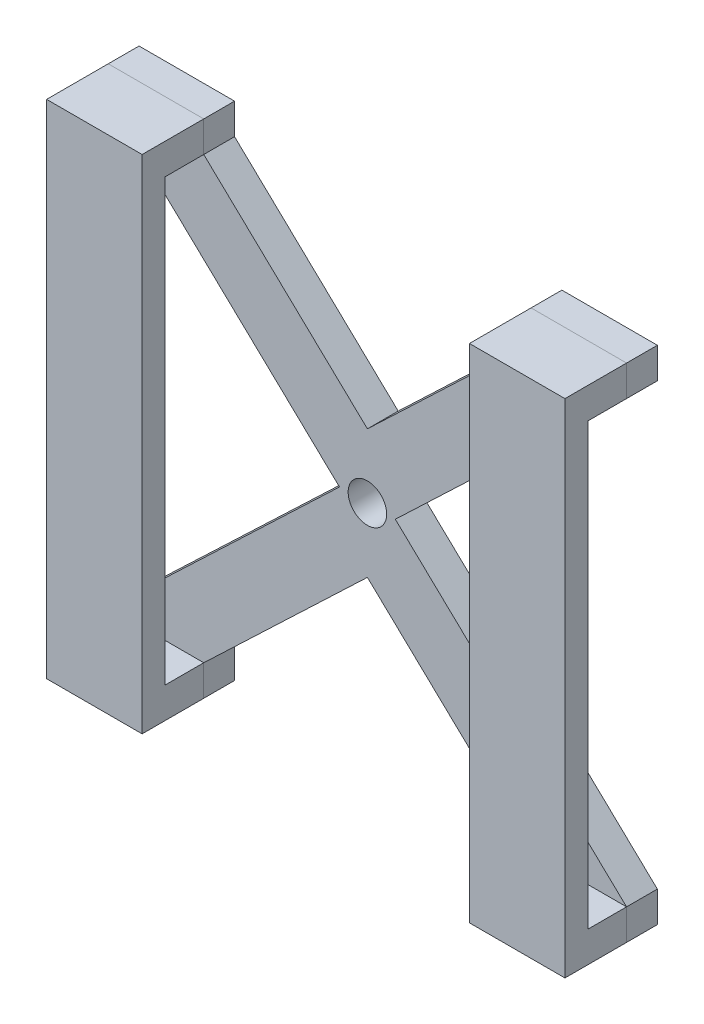
from build123d import *

# Parameters (mm, degrees)
DODANIE_WYCI_GNI_CIE1_DEPTH = 4
SZKIC2_W                    = 12.398850507
SZKIC2_H                    = 4
DODANIE_WYCI_GNI_CIE2_DEPTH = 8
SZKIC3_W                    = 12.398850507
SZKIC3_H                    = 65.15
DODANIE_WYCI_GNI_CIE3_DEPTH = 3
SZKIC4_R                    = 2.5
WYTNIJ_WYCI_GNI_CIE1_DEPTH  = 10


with BuildPart() as part:
    # Szkic1 → Dodanie-wyciągnięcie1 (new body)
    with BuildSketch(Plane.XY):
        Polygon((21.25, -28.575), (0, -8.351140655), (-21.25, -28.575), (-21.25, -32.575), (-33.648850507, -32.575), (-33.648850507, -28.575), (-27.730490071, -22.942431105), (-3.623980395, 0), (-27.730490071, 22.942431105), (-33.648850507, 28.575), (-33.648850507, 32.575), (-21.25, 32.575), (-21.25, 28.575), (0, 8.351140655), (21.25, 28.575), (21.25, 32.575), (33.648850507, 32.575), (33.648850507, 28.575), (27.730490071, 22.942431105), (3.623980395, 0), (27.730490071, -22.942431105), (33.648850507, -28.575), (33.648850507, -32.575), (21.25, -32.575), align=None)
    extrude(amount=DODANIE_WYCI_GNI_CIE1_DEPTH)

    # Szkic2 → Dodanie-wyciągnięcie2 (add)
    with BuildSketch(Plane.XY.offset(4)):
        with Locations((-27.449425253, 30.575)):
            Rectangle(SZKIC2_W, SZKIC2_H)
        with Locations((27.449425253, 30.575)):
            Rectangle(SZKIC2_W, SZKIC2_H)
        with Locations((27.449425253, -30.575)):
            Rectangle(SZKIC2_W, SZKIC2_H)
        with Locations((-27.449425253, -30.575)):
            Rectangle(SZKIC2_W, SZKIC2_H)
    extrude(amount=DODANIE_WYCI_GNI_CIE2_DEPTH)

    # Szkic3 → Dodanie-wyciągnięcie3 (add)
    with BuildSketch(Plane.XY.offset(12)):
        with Locations((-27.449425253, 0)):
            Rectangle(SZKIC3_W, SZKIC3_H)
        with Locations((27.449425253, 0)):
            Rectangle(SZKIC3_W, SZKIC3_H)
    extrude(amount=-DODANIE_WYCI_GNI_CIE3_DEPTH)


with BuildPart() as body_2:
    # Podziel1: the piece on the far side of the plane
    add(part.part)
    split(bisect_by=Plane.XY.offset(4), keep=Keep.BOTTOM)

    # Szkic4 → Wytnij-wyciągnięcie1 (cut)
    with BuildSketch(Plane(origin=(0, 0, 0), x_dir=(-1, 0, 0), z_dir=(0, 0, -1))):
        Circle(SZKIC4_R)
    extrude(amount=-WYTNIJ_WYCI_GNI_CIE1_DEPTH, mode=Mode.SUBTRACT)


with BuildPart() as part_1:
    add(part.part)

    # Podziel1
    split(bisect_by=Plane.XY.offset(4), keep=Keep.TOP)


solid = Compound([body_2.part, part_1.part])
